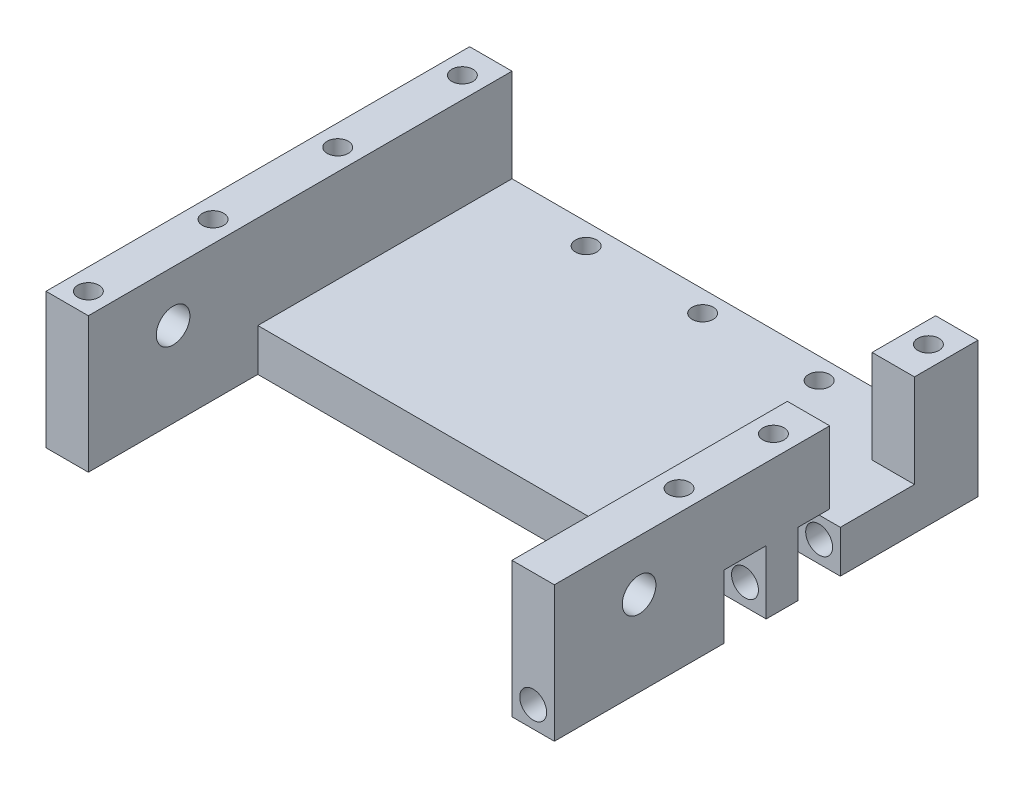
from build123d import *

# Parameters (mm, degrees)
BOSS_EXTRUDE3_DEPTH       = 50
SKETCH7_W                 = 100
SKETCH7_H                 = 40
CUT_EXTRUDE1_DEPTH        = 82.1418511
SKETCH8_R                 = 3.96875
CUT_EXTRUDE2_DEPTH        = 132.848397791
CUT_EXTRUDE3_REACH        = 133.848
SKETCH9_W                 = 20
SKETCH9_H                 = 22
SKETCH10_R                = 3.175
CUT_EXTRUDE4_DEPTH        = 80
SKETCH11_W                = 12.7
SKETCH11_H                = 10
CUT_EXTRUDE5_DEPTH        = 15
F_5_0MM_DOWEL_HOLE1_D     = 5
F_5_0MM_DOWEL_HOLE1_DEPTH = 25
F_5_0MM_DOWEL_HOLE1_TIP   = 1.502151548
SKETCH15_R                = 2.5
CUT_EXTRUDE6_DEPTH        = 15


with BuildPart() as part:
    # Sketch6 → Boss-Extrude3 (new, symmetric)
    with BuildSketch(Plane.XY):
        Polygon((-60, 22), (-50, 22), (-50, 0), (50, 0), (50, 22), (60, 22), (60, -10), (-60, -10), align=None)
    extrude(amount=BOSS_EXTRUDE3_DEPTH, both=True)

    # Sketch7 → Cut-Extrude1 (cut, through all)
    with BuildSketch(Plane(origin=(0, 0, 0), x_dir=(1, 0, 0), z_dir=(0, 1, 0))):
        with Locations((0, -30)):
            Rectangle(SKETCH7_W, SKETCH7_H)
    extrude(amount=-CUT_EXTRUDE1_DEPTH, mode=Mode.SUBTRACT)

    # Sketch8 → Cut-Extrude2 (cut, through all)
    with BuildSketch(Plane(origin=(60, 0, 0), x_dir=(0, 0, -1), z_dir=(1, 0, 0))):
        with Locations((-30, 10)):
            Circle(SKETCH8_R)
    extrude(amount=-CUT_EXTRUDE2_DEPTH, mode=Mode.SUBTRACT)

    # Sketch9 → Cut-Extrude3 (cut, up to next)
    with BuildSketch(Plane(origin=(60, 0, 0), x_dir=(0, 0, -1), z_dir=(1, 0, 0)), mode=Mode.PRIVATE) as cut_extrude3_sk1:
        with Locations((25, 11)):
            Rectangle(SKETCH9_W, SKETCH9_H)
    cut_extrude3_tool1 = extrude(cut_extrude3_sk1.sketch, amount=-CUT_EXTRUDE3_REACH, mode=Mode.PRIVATE) & part.part
    add(cut_extrude3_tool1.solids().sort_by_distance((60, 11, -25))[0], mode=Mode.SUBTRACT)

    # Sketch10 → Cut-Extrude4 (cut)
    with BuildSketch(Plane.XY.offset(50)):
        with Locations((55, -5)):
            Circle(SKETCH10_R)
    extrude(amount=-CUT_EXTRUDE4_DEPTH, mode=Mode.SUBTRACT)

    # Sketch11 → Cut-Extrude5 (cut)
    with BuildSketch(Plane.XZ.offset(10)):
        with Locations((53.65, 5)):
            Rectangle(SKETCH11_W, SKETCH11_H)
        with Locations((53.65, -12.5)):
            Rectangle(SKETCH11_W, SKETCH11_H)
    extrude(amount=-CUT_EXTRUDE5_DEPTH, mode=Mode.SUBTRACT)

    # Ø5.0mm Dowel Hole1
    with Locations(Plane(origin=(-676.293536786, 42.00000002, -1303.282701689), x_dir=(1, 0, 0), z_dir=(0, 1, 0))):
        with Locations((731.293536786, -1318.853535022), (621.293536786, -1318.853535022), (621.293536786, -1348.282701689), (621.293536786, -1259.995201689), (731.293536786, -1259.995201689), (731.293536786, -1296.570201689), (621.293536786, -1289.424368355)):
            Hole(F_5_0MM_DOWEL_HOLE1_D / 2, depth=F_5_0MM_DOWEL_HOLE1_DEPTH)
            with Locations((0, 0, -(F_5_0MM_DOWEL_HOLE1_DEPTH + F_5_0MM_DOWEL_HOLE1_TIP / 2))):  # 118° drill point
                Cone(0, F_5_0MM_DOWEL_HOLE1_D / 2, F_5_0MM_DOWEL_HOLE1_TIP, mode=Mode.SUBTRACT)

    # Sketch15 → Cut-Extrude6 (cut)
    with BuildSketch(Plane.XZ.offset(10)):
        with Locations((-55, -45)):
            Circle(SKETCH15_R)
        with Locations((-27.5, -45)):
            Circle(SKETCH15_R)
        with Locations((0, -45)):
            Circle(SKETCH15_R)
        with Locations((27.5, -45)):
            Circle(SKETCH15_R)
        with Locations((55, -45)):
            Circle(SKETCH15_R)
    extrude(amount=-CUT_EXTRUDE6_DEPTH, mode=Mode.SUBTRACT)


solid = part.part
